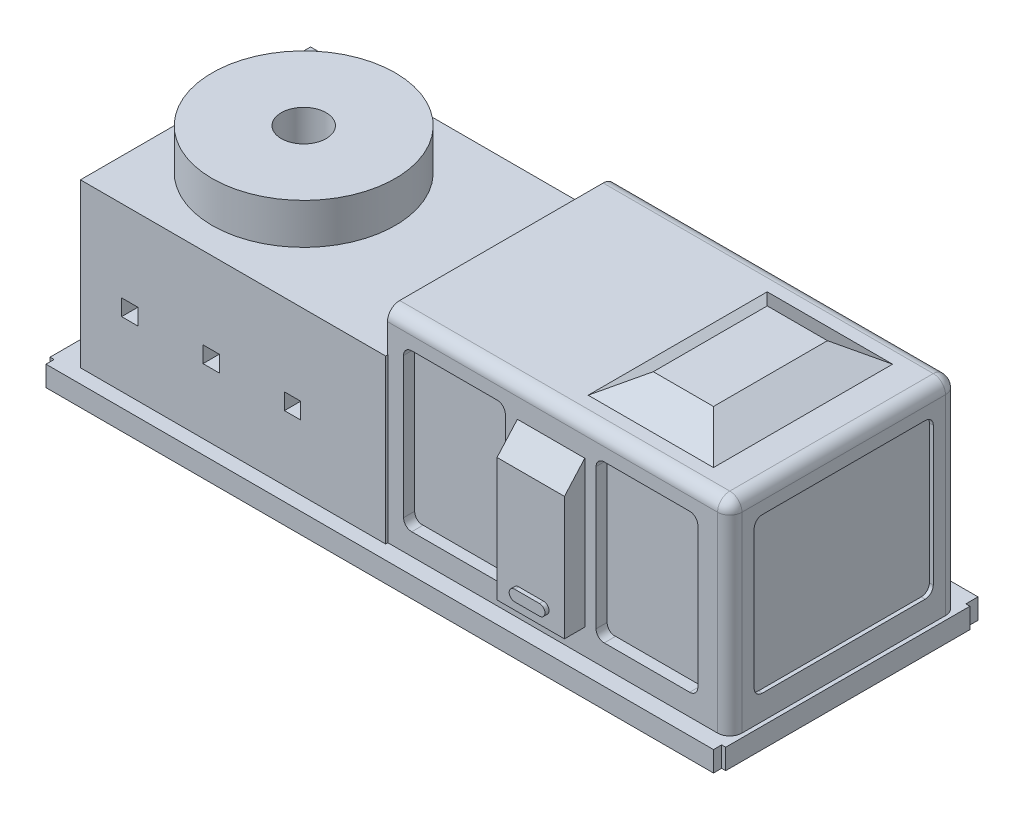
from build123d import *

# Parameters (mm, degrees)
SKETCH2_W               = 160
SKETCH2_H               = 60
BOSS_EXTRUDE1_DEPTH     = 5
SKETCH6_W               = 80
SKETCH6_H               = 56
BOSS_EXTRUDE5_DEPTH     = 50
SKETCH7_W               = 75
SKETCH7_H               = 56.538280722
BOSS_EXTRUDE6_DEPTH     = 40
SKETCH8_W               = 60
SKETCH8_H               = 5
BOSS_EXTRUDE7_DEPTH     = 3
SKETCH9_W               = 60
SKETCH9_H               = 5
BOSS_EXTRUDE8_DEPTH     = 3
SKETCH10_R              = 22.5
BOSS_EXTRUDE9_DEPTH     = 10
SKETCH14_W              = 61.701559037
SKETCH14_H              = 25.260369807
CUT_EXTRUDE2_DEPTH      = 20
SKETCH15_R              = 6
BOSS_EXTRUDE10_DEPTH    = 2
SKETCH16_R              = 5
CUT_EXTRUDE3_DEPTH      = 1
SKETCH17_R              = 4
BOSS_EXTRUDE11_DEPTH    = 30
MIRROR2_COPY_1_SKETCH_R = 6
MIRROR2_COPY_1_DEPTH    = 2
MIRROR2_COPY_2_SKETCH_R = 5
MIRROR2_COPY_2_DEPTH    = 1
MIRROR2_COPY_3_SKETCH_R = 4
MIRROR2_COPY_3_DEPTH    = 30
MIRROR2_COPY_4_SKETCH_R = 5
MIRROR2_COPY_4_DEPTH    = 1
SKETCH19_W              = 25
SKETCH19_H              = 38.512332501
CUT_EXTRUDE4_DEPTH      = 184.12017915
SKETCH20_W              = 48
SKETCH20_H              = 42
CUT_EXTRUDE5_DEPTH      = 80
SKETCH21_W              = 54.661783845
SKETCH21_H              = 48.243165287
CUT_EXTRUDE7_DEPTH      = 80
SKETCH22_W              = 56
SKETCH22_H              = 50
BOSS_EXTRUDE12_DEPTH    = 4
SKETCH23_W              = 44
SKETCH23_H              = 38
CUT_EXTRUDE8_DEPTH      = 4
SKETCH27_W              = 0.871645774
SKETCH27_H              = 38.546113091
BOSS_EXTRUDE14_DEPTH    = 25
MIRROR10_START          = 10.339595333
MIRROR10_OUTLINE_W      = 25
MIRROR10_OUTLINE_H      = 0.871645774
MIRROR10_OUTLINE_H_2    = 0.871645773
MIRROR10_DEPTH          = 38.444260284
SKETCH31_W              = 2.292766789
SKETCH31_H              = 38
BOSS_EXTRUDE15_DEPTH    = 44
FILLET1_R               = 2
SKETCH34_W              = 16.6
SKETCH34_H              = 24.177837003
BOSS_EXTRUDE16_DEPTH    = 5
SKETCH35_W              = 16.6
SKETCH35_H              = 4.731765579
BOSS_EXTRUDE17_DEPTH    = 5
BOSS_EXTRUDE18_DEPTH    = 1
SKETCH38_W              = 56
SKETCH38_H              = 10
BOSS_EXTRUDE19_DEPTH    = 0.1
SKETCH41_W              = 10
SKETCH41_H              = 10
BOSS_EXTRUDE20_DEPTH    = 9
SKETCH42_R              = 20
BOSS_EXTRUDE21_DEPTH    = 5
SKETCH44_W              = 4
SKETCH44_H              = 4
CUT_EXTRUDE11_DEPTH     = 5
SKETCH51_R              = 2.5
CUT_EXTRUDE15_DEPTH     = 10
FILLET2_R               = 3
FILLET3_R               = 3
FILLET4_R               = 3
SKETCH45_R              = 5.515987331
CUT_EXTRUDE12_DEPTH     = 10
SKETCH5_W               = 164
SKETCH5_H               = 74
BOSS_EXTRUDE4_DEPTH     = 5
SKETCH53_W              = 164
SKETCH53_H              = 9.012690386
CUT_EXTRUDE16_DEPTH     = 10


# Read off the part's stored shape, not the designer's step: Mirror10
with BuildPart() as part:
    # Sketch2 → Boss-Extrude1 (new body)
    with BuildSketch(Plane(origin=(0, 0, 0), x_dir=(1, 0, 0), z_dir=(0, 1, 0))):
        with Locations((80, 30)):
            Rectangle(SKETCH2_W, SKETCH2_H)
    extrude(amount=BOSS_EXTRUDE1_DEPTH)

    # Sketch6 → Boss-Extrude5 (add)
    with BuildSketch(Plane(origin=(0, 5, 0), x_dir=(1, 0, 0), z_dir=(0, 1, 0))):
        with Locations((118, 30)):
            Rectangle(SKETCH6_W, SKETCH6_H)
    extrude(amount=BOSS_EXTRUDE5_DEPTH)

    # Sketch7 → Boss-Extrude6 (add)
    with BuildSketch(Plane(origin=(0, 5, 0), x_dir=(1, 0, 0), z_dir=(0, 1, 0))):
        with Locations((40.5, 29.730859639)):
            Rectangle(SKETCH7_W, SKETCH7_H)
    extrude(amount=BOSS_EXTRUDE6_DEPTH)

    # Sketch8 → Boss-Extrude7 (add)
    with BuildSketch(Plane.ZY):
        with Locations((-30, 2.5)):
            Rectangle(SKETCH8_W, SKETCH8_H)
    extrude(amount=BOSS_EXTRUDE7_DEPTH)

    # Sketch9 → Boss-Extrude8 (add)
    with BuildSketch(Plane(origin=(160, 0, 0), x_dir=(0, 0, -1), z_dir=(1, 0, 0))):
        with Locations((30, 2.5)):
            Rectangle(SKETCH9_W, SKETCH9_H)
    extrude(amount=BOSS_EXTRUDE8_DEPTH)

    # Sketch10 → Boss-Extrude9 (add)
    with BuildSketch(Plane(origin=(0, 45, 0), x_dir=(1, 0, 0), z_dir=(0, 1, 0))):
        with Locations(Location((28.905076154, 30.414104423, 0), (0, 0, 90))):
            Circle(SKETCH10_R)
    extrude(amount=BOSS_EXTRUDE9_DEPTH)

    # Sketch13 → Loft5 section 0
    with BuildSketch(Plane(origin=(0, 60, 0), x_dir=(1, 0, 0), z_dir=(0, 1, 0))):
        with BuildLine():
            Line((129.203390095, 16), (144, 16))
            Line((144, 16), (144, 44))
            Line((144, 44), (129.203390095, 44))
            Line((129.203390095, 44), (129.203390095, 16))
        make_face()
    # Sketch11 → Loft5 section 1
    with BuildSketch(Plane(origin=(0, 55, 0), x_dir=(1, 0, 0), z_dir=(0, 1, 0))):
        with BuildLine():
            Line((152, 52), (121.203390095, 52))
            Line((121.203390095, 52), (121.203390095, 8))
            Line((121.203390095, 8), (152, 8))
            Line((152, 8), (152, 52))
        make_face()
    loft()

    # Sketch14 → Cut-Extrude2 (cut)
    with BuildSketch(Plane(origin=(0, 0, -58), x_dir=(-1, 0, 0), z_dir=(0, 0, -1))):
        with Locations((-41.281236444, 24.823744712)):
            Rectangle(SKETCH14_W, SKETCH14_H)
    extrude(amount=-CUT_EXTRUDE2_DEPTH, mode=Mode.SUBTRACT)

    # Sketch15 → Boss-Extrude10 (add)
    with BuildSketch(Plane.ZY.offset(-72.132015962)):
        with Locations(Location((-48.207711712, 25, 0), (0, 0, 180))):
            Circle(SKETCH15_R)
    boss_extrude10 = extrude(amount=BOSS_EXTRUDE10_DEPTH)

    # Sketch16 → Cut-Extrude3 (cut)
    with BuildSketch(Plane.ZY.offset(-70.132015962)):
        with Locations((-48.207711712, 25)):
            Circle(SKETCH16_R)
    cut_extrude3 = extrude(amount=-CUT_EXTRUDE3_DEPTH, mode=Mode.SUBTRACT)

    # Sketch17 → Boss-Extrude11 (add)
    with BuildSketch(Plane.ZY.offset(-71.132015962)):
        with Locations((-48.207711712, 25)):
            Circle(SKETCH17_R)
    boss_extrude11 = extrude(amount=BOSS_EXTRUDE11_DEPTH)

    # Mirror1: Boss-Extrude10, Cut-Extrude3, Boss-Extrude11 across plane
    add(boss_extrude10.mirror(Plane.ZY.offset(-41.232015962)))
    add(cut_extrude3.mirror(Plane.ZY.offset(-41.232015962)), mode=Mode.SUBTRACT)
    add(boss_extrude11.mirror(Plane.ZY.offset(-41.232015962)))

    # Mirror2: Boss-Extrude10, Boss-Extrude11 across plane
    add(boss_extrude10.mirror(Plane(origin=(0, 0, -28), x_dir=(1, 0, 0), z_dir=(0, 0, -1))))
    add(boss_extrude11.mirror(Plane(origin=(0, 0, -28), x_dir=(1, 0, 0), z_dir=(0, 0, -1))))

    # Mirror2 copy 1 sketch → Mirror2 copy 1 (add)
    with BuildSketch(Plane(origin=(10.332015962, 0, -56), x_dir=(0, 0, -1), z_dir=(1, 0, 0))):
        with Locations(Location((-48.207711712, 25, 0), (0, 0, 180))):
            Circle(MIRROR2_COPY_1_SKETCH_R)
    extrude(amount=MIRROR2_COPY_1_DEPTH)

    # Mirror2 copy 2 sketch → Mirror2 copy 2 (cut)
    with BuildSketch(Plane(origin=(12.332015962, 0, -56), x_dir=(0, 0, -1), z_dir=(1, 0, 0))):
        with Locations((-48.207711712, 25)):
            Circle(MIRROR2_COPY_2_SKETCH_R)
    extrude(amount=-MIRROR2_COPY_2_DEPTH, mode=Mode.SUBTRACT)

    # Mirror2 copy 3 sketch → Mirror2 copy 3 (add)
    with BuildSketch(Plane(origin=(11.332015962, 0, -56), x_dir=(0, 0, -1), z_dir=(1, 0, 0))):
        with Locations((-48.207711712, 25)):
            Circle(MIRROR2_COPY_3_SKETCH_R)
    extrude(amount=MIRROR2_COPY_3_DEPTH)

    # Mirror2 copy 4 sketch → Mirror2 copy 4 (cut)
    with BuildSketch(Plane(origin=(70.132015962, 0, -56), x_dir=(0, 0, -1), z_dir=(-1, 0, 0))):
        with Locations((-48.207711712, -25)):
            Circle(MIRROR2_COPY_4_SKETCH_R)
    extrude(amount=-MIRROR2_COPY_4_DEPTH, mode=Mode.SUBTRACT)

    # Sketch19 → Cut-Extrude4 (cut, through all)
    with BuildSketch(Plane(origin=(0, 0, -58), x_dir=(-1, 0, 0), z_dir=(0, 0, -1))):
        with Locations((-141.647866047, 29.527689366)):
            Rectangle(SKETCH19_W, SKETCH19_H)
    cut_extrude4 = extrude(amount=-CUT_EXTRUDE4_DEPTH, mode=Mode.SUBTRACT)

    # Mirror3: Cut-Extrude4 across plane
    add(cut_extrude4.mirror(Plane(origin=(118, 0, 0), x_dir=(0, 0, 1), z_dir=(1, 0, 0))), mode=Mode.SUBTRACT)

    # Sketch20 → Cut-Extrude5 (cut)
    with BuildSketch(Plane(origin=(158, 0, 0), x_dir=(0, 0, -1), z_dir=(1, 0, 0))):
        with Locations((30, 30)):
            Rectangle(SKETCH20_W, SKETCH20_H)
    extrude(amount=-CUT_EXTRUDE5_DEPTH, mode=Mode.SUBTRACT)

    # Sketch21 → Cut-Extrude7 (cut)
    with BuildSketch(Plane(origin=(0, 9, 0), x_dir=(1, 0, 0), z_dir=(0, 1, 0))):
        with Locations((127.000852017, 29.689421683)):
            Rectangle(SKETCH21_W, SKETCH21_H)
    extrude(amount=-CUT_EXTRUDE7_DEPTH, mode=Mode.SUBTRACT)

    # Sketch22 → Boss-Extrude12 (add)
    with BuildSketch(Plane(origin=(158, 0, 0), x_dir=(0, 0, -1), z_dir=(1, 0, 0))):
        with Locations((30, 30)):
            Rectangle(SKETCH22_W, SKETCH22_H)
    extrude(amount=BOSS_EXTRUDE12_DEPTH)

    # Sketch23 → Cut-Extrude8 (cut)
    with BuildSketch(Plane(origin=(162, 0, 0), x_dir=(0, 0, -1), z_dir=(1, 0, 0))):
        with Locations((30, 30)):
            Rectangle(SKETCH23_W, SKETCH23_H)
    extrude(amount=-CUT_EXTRUDE8_DEPTH, mode=Mode.SUBTRACT)

    # Sketch27 → Boss-Extrude14 (add)
    with BuildSketch(Plane(origin=(129.147866047, 0, 0), x_dir=(0, 0, -1), z_dir=(1, 0, 0))):
        with Locations((54.841904543, 29.612651878)):
            Rectangle(SKETCH27_W, SKETCH27_H)
    boss_extrude14 = extrude(amount=BOSS_EXTRUDE14_DEPTH)

    # Mirror7: Boss-Extrude14 across plane
    add(boss_extrude14.mirror(Plane(origin=(118, 0, 0), x_dir=(0, 0, 1), z_dir=(1, 0, 0))))

    # Mirror10 outline → Mirror10 (add)
    with BuildSketch(Plane(origin=(0, 0, 0), x_dir=(1, 0, 0), z_dir=(0, 1, 0)).offset(MIRROR10_START)):
        with Locations((94.352133953, 5.158095457)):
            Rectangle(MIRROR10_OUTLINE_W, MIRROR10_OUTLINE_H)
        with Locations((141.647866047, 5.158095457)):
            Rectangle(MIRROR10_OUTLINE_W, MIRROR10_OUTLINE_H)
        with Locations((94.352133953, 55.713550317)):
            Rectangle(MIRROR10_OUTLINE_W, MIRROR10_OUTLINE_H_2)
        with Locations((141.647866047, 55.713550317)):
            Rectangle(MIRROR10_OUTLINE_W, MIRROR10_OUTLINE_H_2)
    extrude(amount=MIRROR10_DEPTH)

    # Sketch31 → Boss-Extrude15 (add)
    with BuildSketch(Plane(origin=(0, 0, -8), x_dir=(-1, 0, 0), z_dir=(0, 0, -1))):
        with Locations((-159.892131675, 30)):
            Rectangle(SKETCH31_W, SKETCH31_H)
    extrude(amount=BOSS_EXTRUDE15_DEPTH)

    # Fillet1
    # the kernel refuses this fillet: 2 mm, written as the material it adds along each edge
    with BuildSketch(Plane(origin=(106.852133953, 10.271523116, -6), x_dir=(-1, 0, 0), z_dir=(0, 0, 1)), Plane(origin=(129.147866047, 10.271523116, -6), x_dir=(0, 1, 0), z_dir=(0, 0, 1)), Plane(origin=(81.852133953, 10.271523116, -6), x_dir=(0, 1, 0), z_dir=(0, 0, 1)), Plane(origin=(81.852133953, 10.271523116, -58), x_dir=(0, 1, 0), z_dir=(0, 0, 1)), Plane(origin=(106.852133953, 10.271523116, -58), x_dir=(-1, 0, 0), z_dir=(0, 0, 1)), Plane(origin=(129.147866047, 10.271523116, -58), x_dir=(0, 1, 0), z_dir=(0, 0, 1)), Plane(origin=(154.147866047, 10.271523116, -58), x_dir=(-1, 0, 0), z_dir=(0, 0, 1))) as fillet1_piece_1:
        with BuildLine():
            CenterArc((FILLET1_R, -FILLET1_R), FILLET1_R, 90, 90)
            Line((0, -FILLET1_R), (0, 0))
            Line((0, 0), (FILLET1_R, 0))
        make_face()
    extrude(amount=4)
    with BuildSketch(Plane(origin=(106.852133953, 48.783855617, -9.72227257), x_dir=(-1, 0, 0), z_dir=(0, 0, 1))) as fillet1_piece_2_section:
        with BuildLine():
            CenterArc((FILLET1_R, FILLET1_R), FILLET1_R, 180, 90)
            Line((0, FILLET1_R), (0, 0))
            Line((0, 0), (FILLET1_R, 0))
        make_face()
    fillet1_piece_2 = extrude(amount=7.72227257, mode=Mode.PRIVATE)
    fillet1_piece_2 = split(fillet1_piece_2, bisect_by=Plane(origin=(106.405398075, 48.33711974, -5.593918344), z_dir=(0, 0, 1)), keep=Keep.TOP, mode=Mode.PRIVATE)
    add(fillet1_piece_2)
    with BuildSketch(Plane(origin=(81.852133953, 48.783855617, -9.72227257), x_dir=(1, 0, 0), z_dir=(0, 0, 1))) as fillet1_piece_3_section:
        with BuildLine():
            CenterArc((FILLET1_R, -FILLET1_R), FILLET1_R, 90, 90)
            Line((0, -FILLET1_R), (0, 0))
            Line((0, 0), (FILLET1_R, 0))
        make_face()
    fillet1_piece_3 = extrude(amount=7.72227257, mode=Mode.PRIVATE)
    fillet1_piece_3 = split(fillet1_piece_3, bisect_by=Plane(origin=(82.298869831, 48.33711974, -5.593918344), z_dir=(0, 0, 1)), keep=Keep.TOP, mode=Mode.PRIVATE)
    add(fillet1_piece_3)
    with BuildSketch(Plane(origin=(129.147866047, 48.783855617, -4.72227257), x_dir=(1, 0, 0), z_dir=(0, 0, 1)), Plane(origin=(154.147866047, 48.783855617, -4.72227257), x_dir=(0, -1, 0), z_dir=(0, 0, 1))) as fillet1_piece_4:
        with BuildLine():
            CenterArc((FILLET1_R, -FILLET1_R), FILLET1_R, 90, 90)
            Line((0, -FILLET1_R), (0, 0))
            Line((0, 0), (FILLET1_R, 0))
        make_face()
    extrude(amount=2.72227257)
    with BuildSketch(Plane(origin=(154.147866047, 10.271523116, -6), x_dir=(0, 1, 0), z_dir=(0, 0, 1))) as fillet1_piece_5:
        with BuildLine():
            CenterArc((FILLET1_R, FILLET1_R), FILLET1_R, 180, 90)
            Line((0, FILLET1_R), (0, 0))
            Line((0, 0), (FILLET1_R, 0))
        make_face()
    extrude(amount=4)
    with BuildSketch(Plane(origin=(162, 11, -8), x_dir=(0, 0, -1), z_dir=(-1, 0, 0))) as fillet1_piece_6_section:
        with BuildLine():
            CenterArc((FILLET1_R, -FILLET1_R), FILLET1_R, 90, 90)
            Line((0, -FILLET1_R), (0, 0))
            Line((0, 0), (FILLET1_R, 0))
        make_face()
    fillet1_piece_6 = extrude(amount=5.961484931, mode=Mode.PRIVATE)
    fillet1_piece_6 = split(fillet1_piece_6, bisect_by=Plane(origin=(158.74574828, 11.446735878, -8.446735878), z_dir=(1, 0, 0)), keep=Keep.TOP, mode=Mode.PRIVATE)
    add(fillet1_piece_6)
    with BuildSketch(Plane(origin=(162, 49, -8), x_dir=(0, 0, -1), z_dir=(-1, 0, 0))) as fillet1_piece_7_section:
        with BuildLine():
            CenterArc((FILLET1_R, FILLET1_R), FILLET1_R, 180, 90)
            Line((0, FILLET1_R), (0, 0))
            Line((0, 0), (FILLET1_R, 0))
        make_face()
    fillet1_piece_7 = extrude(amount=5.961484931, mode=Mode.PRIVATE)
    fillet1_piece_7 = split(fillet1_piece_7, bisect_by=Plane(origin=(158.74574828, 48.553264122, -8.446735878), z_dir=(1, 0, 0)), keep=Keep.TOP, mode=Mode.PRIVATE)
    add(fillet1_piece_7)
    with BuildSketch(Plane(origin=(162, 11, -52), x_dir=(0, 1, 0), z_dir=(-1, 0, 0))) as fillet1_piece_8_section:
        with BuildLine():
            CenterArc((FILLET1_R, -FILLET1_R), FILLET1_R, 90, 90)
            Line((0, -FILLET1_R), (0, 0))
            Line((0, 0), (FILLET1_R, 0))
        make_face()
    fillet1_piece_8 = extrude(amount=5.961484931, mode=Mode.PRIVATE)
    fillet1_piece_8 = split(fillet1_piece_8, bisect_by=Plane(origin=(158.74574828, 11.446735878, -51.553264122), z_dir=(1, 0, 0)), keep=Keep.TOP, mode=Mode.PRIVATE)
    add(fillet1_piece_8)
    with BuildSketch(Plane(origin=(162, 49, -52), x_dir=(0, 0, 1), z_dir=(-1, 0, 0))) as fillet1_piece_9_section:
        with BuildLine():
            CenterArc((FILLET1_R, -FILLET1_R), FILLET1_R, 90, 90)
            Line((0, -FILLET1_R), (0, 0))
            Line((0, 0), (FILLET1_R, 0))
        make_face()
    fillet1_piece_9 = extrude(amount=5.961484931, mode=Mode.PRIVATE)
    fillet1_piece_9 = split(fillet1_piece_9, bisect_by=Plane(origin=(158.74574828, 48.553264122, -51.553264122), z_dir=(1, 0, 0)), keep=Keep.TOP, mode=Mode.PRIVATE)
    add(fillet1_piece_9)
    with BuildSketch(Plane(origin=(154.147866047, 48.783855617, -58), x_dir=(-1, 0, 0), z_dir=(0, 0, 1))) as fillet1_piece_10_section:
        with BuildLine():
            CenterArc((FILLET1_R, FILLET1_R), FILLET1_R, 180, 90)
            Line((0, FILLET1_R), (0, 0))
            Line((0, 0), (FILLET1_R, 0))
        make_face()
    fillet1_piece_10 = extrude(amount=6.850626797, mode=Mode.PRIVATE)
    fillet1_piece_10 = split(fillet1_piece_10, bisect_by=Plane(origin=(153.701130169, 48.33711974, -54.406081656), z_dir=(0, 0, -1)), keep=Keep.TOP, mode=Mode.PRIVATE)
    add(fillet1_piece_10)
    with BuildSketch(Plane(origin=(106.852133953, 48.783855617, -58), x_dir=(0, -1, 0), z_dir=(0, 0, 1))) as fillet1_piece_11_section:
        with BuildLine():
            CenterArc((FILLET1_R, -FILLET1_R), FILLET1_R, 90, 90)
            Line((0, -FILLET1_R), (0, 0))
            Line((0, 0), (FILLET1_R, 0))
        make_face()
    fillet1_piece_11 = extrude(amount=6.850626797, mode=Mode.PRIVATE)
    fillet1_piece_11 = split(fillet1_piece_11, bisect_by=Plane(origin=(106.405398075, 48.33711974, -54.406081656), z_dir=(0, 0, -1)), keep=Keep.TOP, mode=Mode.PRIVATE)
    add(fillet1_piece_11)
    with BuildSketch(Plane(origin=(81.852133953, 48.783855617, -58), x_dir=(0, -1, 0), z_dir=(0, 0, 1))) as fillet1_piece_12_section:
        with BuildLine():
            CenterArc((FILLET1_R, FILLET1_R), FILLET1_R, 180, 90)
            Line((0, FILLET1_R), (0, 0))
            Line((0, 0), (FILLET1_R, 0))
        make_face()
    fillet1_piece_12 = extrude(amount=6.850626797, mode=Mode.PRIVATE)
    fillet1_piece_12 = split(fillet1_piece_12, bisect_by=Plane(origin=(82.298869831, 48.33711974, -54.406081656), z_dir=(0, 0, -1)), keep=Keep.TOP, mode=Mode.PRIVATE)
    add(fillet1_piece_12)
    with BuildSketch(Plane(origin=(129.147866047, 48.783855617, -58), x_dir=(1, 0, 0), z_dir=(0, 0, 1))) as fillet1_piece_13_section:
        with BuildLine():
            CenterArc((FILLET1_R, -FILLET1_R), FILLET1_R, 90, 90)
            Line((0, -FILLET1_R), (0, 0))
            Line((0, 0), (FILLET1_R, 0))
        make_face()
    fillet1_piece_13 = extrude(amount=6.850626797, mode=Mode.PRIVATE)
    fillet1_piece_13 = split(fillet1_piece_13, bisect_by=Plane(origin=(129.594601925, 48.33711974, -54.406081656), z_dir=(0, 0, -1)), keep=Keep.TOP, mode=Mode.PRIVATE)
    add(fillet1_piece_13)

    # Sketch33 → Loft6 section 0
    with BuildSketch(Plane(origin=(0, 0, -63), x_dir=(-1, 0, 0), z_dir=(0, 0, -1))):
        with BuildLine():
            Line((-126.379695383, 41.562169791), (-109.815518461, 41.562169791))
            Line((-109.815518461, 41.562169791), (-109.815518461, 40.148477073))
            Line((-109.815518461, 40.148477073), (-126.379695383, 40.148477073))
            Line((-126.379695383, 40.148477073), (-126.379695383, 41.562169791))
        make_face()
    # Sketch32 → Loft6 section 1
    with BuildSketch(Plane(origin=(0, 0, -58), x_dir=(-1, 0, 0), z_dir=(0, 0, -1))):
        with BuildLine():
            Line((-126.379695383, 47.185383557), (-109.815518461, 47.185383557))
            Line((-109.815518461, 47.185383557), (-109.815518461, 40.148477073))
            Line((-109.815518461, 40.148477073), (-126.379695383, 40.148477073))
            Line((-126.379695383, 40.148477073), (-126.379695383, 47.185383557))
        make_face()
    loft6 = loft()

    # Sketch34 → Boss-Extrude16 (add)
    with BuildSketch(Plane(origin=(0, 0, -58), x_dir=(-1, 0, 0), z_dir=(0, 0, -1))):
        with Locations((-118.079695383, 28.059558572)):
            Rectangle(SKETCH34_W, SKETCH34_H)
    boss_extrude16 = extrude(amount=BOSS_EXTRUDE16_DEPTH)

    # Sketch35 → Boss-Extrude17 (add)
    with BuildSketch(Plane(origin=(0, 0, -58), x_dir=(-1, 0, 0), z_dir=(0, 0, -1))):
        with Locations((-118.079695383, 13.604757281)):
            Rectangle(SKETCH35_W, SKETCH35_H)
    boss_extrude17 = extrude(amount=BOSS_EXTRUDE17_DEPTH)

    # Sketch36 → Boss-Extrude18 (add)
    with BuildSketch(Plane(origin=(0, 0, -63), x_dir=(-1, 0, 0), z_dir=(0, 0, -1))):
        with BuildLine():
            Line((-121.24858613, 16.696492397), (-115.140207119, 16.696492397))
            ThreePointArc((-115.140207119, 16.696492397), (-113.7942931, 15.350578378), (-115.140207119, 14.004664358))
            Line((-115.140207119, 14.004664358), (-121.24858613, 14.004664358))
            ThreePointArc((-121.24858613, 14.004664358), (-122.594500149, 15.350578378), (-121.24858613, 16.696492397))
        make_face()
    boss_extrude18 = extrude(amount=BOSS_EXTRUDE18_DEPTH)

    # Sketch38 → Boss-Extrude19 (add)
    with BuildSketch(Plane.ZY.offset(-78)):
        with Locations((-30, 50)):
            Rectangle(SKETCH38_W, SKETCH38_H)
    extrude(amount=BOSS_EXTRUDE19_DEPTH)

    # Mirror12: Loft6, Boss-Extrude16, Boss-Extrude18 across plane
    add(loft6.mirror(Plane.XY.offset(-30)))
    add(boss_extrude16.mirror(Plane.XY.offset(-30)))
    add(boss_extrude18.mirror(Plane.XY.offset(-30)))

    # Mirror13: Loft6, Boss-Extrude17 across plane
    add(loft6.mirror(Plane.XY.offset(-30)))
    add(boss_extrude17.mirror(Plane.XY.offset(-30)))

    # Sketch41 → Boss-Extrude20 (add)
    with BuildSketch(Plane.XZ):
        with Locations((23.091388752, -29.202538077)):
            Rectangle(SKETCH41_W, SKETCH41_H)
    extrude(amount=BOSS_EXTRUDE20_DEPTH)

    # Sketch42 → Boss-Extrude21 (add)
    with BuildSketch(Plane(origin=(0, 45, 0), x_dir=(1, 0, 0), z_dir=(0, 1, 0))):
        with Locations((29.112128366, 31.242313269)):
            Circle(SKETCH42_R)
    extrude(amount=BOSS_EXTRUDE21_DEPTH)

    # Sketch44 → Cut-Extrude11 (cut)
    with BuildSketch(Plane.XY.offset(-1.461719278)):
        with Locations((15.122135675, 22.944901346)):
            Rectangle(SKETCH44_W, SKETCH44_H)
        with Locations((35.122135675, 22.944901346)):
            Rectangle(SKETCH44_W, SKETCH44_H)
        with Locations((55.122135675, 22.944901346)):
            Rectangle(SKETCH44_W, SKETCH44_H)
    extrude(amount=-CUT_EXTRUDE11_DEPTH, mode=Mode.SUBTRACT)

    # Sketch51 → Cut-Extrude15 (cut)
    with BuildSketch(Plane(origin=(0, 55, 0), x_dir=(1, 0, 0), z_dir=(0, 1, 0))):
        with Locations(Location((28.905076154, 30.414104423, 0), (0, 0, 270))):
            Circle(SKETCH51_R)
    extrude(amount=-CUT_EXTRUDE15_DEPTH, mode=Mode.SUBTRACT)

    # Fillet2
    fillet2_edges = [part.edges().sort_by_distance(p)[0] for p in [
        (162, 30, -58),
    ]]
    fillet(fillet2_edges, radius=FILLET2_R)

    # Fillet3
    fillet3_edges = [part.edges().sort_by_distance(p)[0] for p in [
        (162, 30, -2),
    ]]
    fillet(fillet3_edges, radius=FILLET3_R)

    # Fillet4
    fillet4_edges = [part.edges().sort_by_distance(p)[0] for p in [
        (162, 55, -30),
        (118.45, 55, -58),
        (161.121320344, 55, -57.121320344),
        (118.45, 55, -2),
        (161.121320344, 55, -2.878679656),
    ]]
    fillet(fillet4_edges, radius=FILLET4_R)

    # Sketch45 → Cut-Extrude12 (cut)
    with BuildSketch(Plane(origin=(0, 55, 0), x_dir=(1, 0, 0), z_dir=(0, 1, 0))):
        with Locations(Location((28.905076154, 30.414104423, 0), (0, 0, 270))):
            Circle(SKETCH45_R)
    extrude(amount=-CUT_EXTRUDE12_DEPTH, mode=Mode.SUBTRACT)

    # Sketch5 → Boss-Extrude4 (add)
    with BuildSketch(Plane.XZ):
        with Locations((80, -35)):
            Rectangle(SKETCH5_W, SKETCH5_H)
    extrude(amount=-BOSS_EXTRUDE4_DEPTH)

    # Sketch53 → Cut-Extrude16 (cut)
    with BuildSketch(Plane.XZ):
        with Locations((80, -67.493654807)):
            Rectangle(SKETCH53_W, SKETCH53_H)
    extrude(amount=-CUT_EXTRUDE16_DEPTH, mode=Mode.SUBTRACT)


solid = part.part
